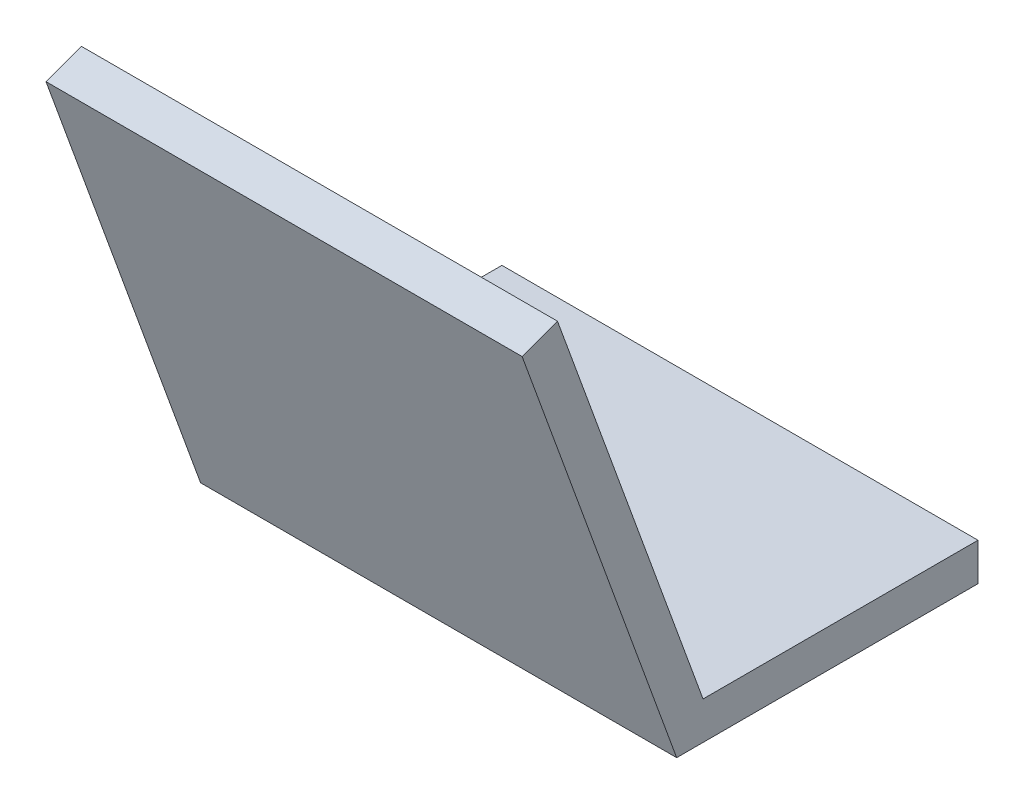
from build123d import *

# Parameters (mm, degrees)
SKETCH2_W           = 40.132
SKETCH2_H           = 25.4
BOSS_EXTRUDE1_DEPTH = 3.175
BOSS_EXTRUDE2_DEPTH = 40.132


with BuildPart() as part:
    # Sketch2 → Boss-Extrude1 (new body)
    with BuildSketch(Plane(origin=(0, 0, 0), x_dir=(1, 0, 0), z_dir=(0, 1, 0))):
        with Locations((-38.371824561, 11.620425731)):
            Rectangle(SKETCH2_W, SKETCH2_H)
    extrude(amount=BOSS_EXTRUDE1_DEPTH)

    # Sketch3 → Boss-Extrude2 (add)
    with BuildSketch(Plane(origin=(-18.305824561, 0, 0), x_dir=(0, 0, -1), z_dir=(1, 0, 0))):
        Polygon((-1.079574269, 0), (-14.11054173, 35.802288852), (-11.127017659, 36.888202807), (1.143584665, 3.175), align=None)
    extrude(amount=-BOSS_EXTRUDE2_DEPTH)


solid = part.part
